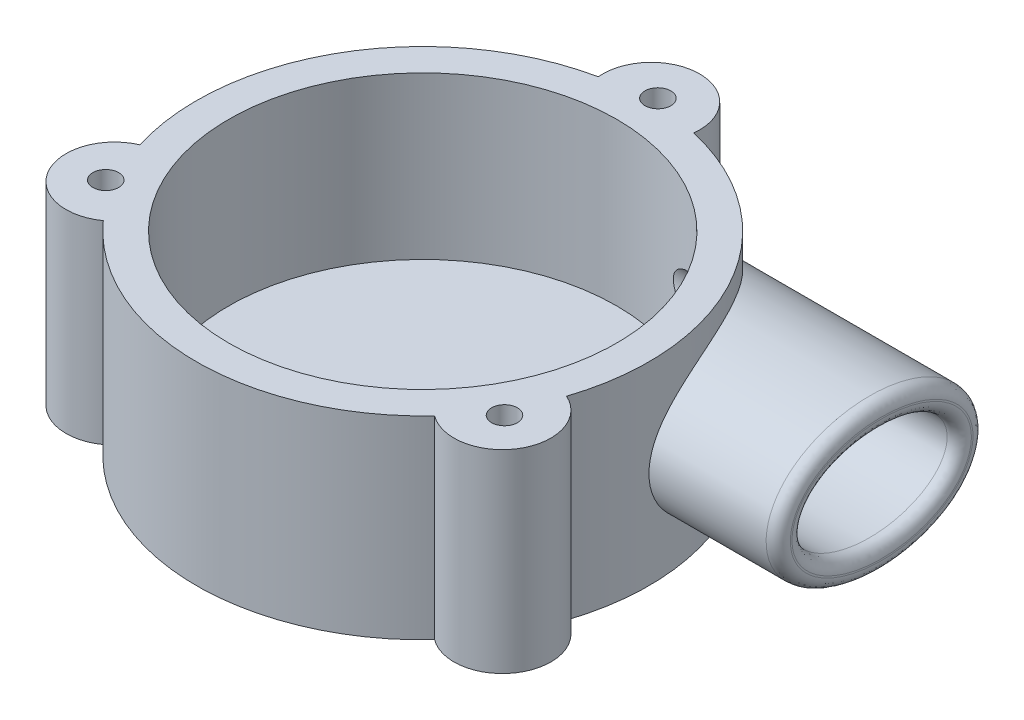
from build123d import *

# Parameters (mm, degrees)
SKETCH1_R           = 28
BOSS_EXTRUDE1_DEPTH = 4
SKETCH2_R           = 28
SKETCH2_R_2         = 24
BOSS_EXTRUDE2_DEPTH = 20
SKETCH3_R           = 0.8
CUT_EXTRUDE1_DEPTH  = 16
SKETCH4_RX          = 9.6
SKETCH4_RY          = 6
CUT_EXTRUDE2_DEPTH  = 30
BOSS_EXTRUDE3_START = -26
BOSS_EXTRUDE3_DEPTH = 42
CUT_EXTRUDE3_START  = -20
SKETCH7_R           = 24
CUT_EXTRUDE3_DEPTH  = 20
BOSS_EXTRUDE4_DEPTH = 24
SKETCH11_R          = 1.6
CUT_EXTRUDE4_DEPTH  = 61.563224081
FILLET2_R           = 1.5


# Read off the part's stored shape, not the designer's step: Boss-Extrude3
with BuildPart() as part:
    # Sketch1 → Boss-Extrude1 (new body)
    with BuildSketch(Plane(origin=(0, 0, 0), x_dir=(1, 0, 0), z_dir=(0, 1, 0))):
        with Locations(Location((0, 0, 0), (0, 0, 270))):
            Circle(SKETCH1_R)
    extrude(amount=BOSS_EXTRUDE1_DEPTH)

    # Sketch2 → Boss-Extrude2 (add)
    with BuildSketch(Plane(origin=(0, 4, 0), x_dir=(1, 0, 0), z_dir=(0, 1, 0))):
        with Locations(Location((0, 0, 0), (0, 0, 270))):
            Circle(SKETCH2_R)
        with Locations(Location((0, 0, 0), (0, 0, 270))):
            Circle(SKETCH2_R_2, mode=Mode.SUBTRACT)
    extrude(amount=BOSS_EXTRUDE2_DEPTH)

    # Sketch3 → Cut-Extrude1 (cut)
    with BuildSketch(Plane(origin=(0, 0, 0), x_dir=(-1, 0, 0), z_dir=(0, -1, 0))):
        with Locations(Location((0, 0, 0), (0, 0, 90))):
            Circle(SKETCH3_R)
    extrude(amount=-CUT_EXTRUDE1_DEPTH, mode=Mode.SUBTRACT)

    # Sketch4 → Cut-Extrude2 (cut)
    with BuildSketch(Plane(origin=(28, 0, 0), x_dir=(0, 0, -1), z_dir=(1, 0, 0))):
        with Locations(Location((12.8, 12), (0, 0, -180))):
            Ellipse(SKETCH4_RX, SKETCH4_RY)
    extrude(amount=-CUT_EXTRUDE2_DEPTH, mode=Mode.SUBTRACT)

    # Boss-Extrude3 outline → Boss-Extrude3 (add)
    # profile 1 of 2: a face of its own
    with BuildSketch(Plane(origin=(28, 0, 0), x_dir=(0, 0, -1), z_dir=(1, 0, 0)).offset(BOSS_EXTRUDE3_START)):
        with BuildLine():
            Line((6.373226639, 3.999999985), (19.226773366, 3.999999987))
            add(Edge.make_bspline(
                [(19.226773366, 3.999999987), (19.948036257, 4.292423909), (21.708793196, 5.1792085), (23.192402394, 6.437838641), (23.916521487, 7.355553728)],
                knots=[5.287932053, 5.287932053, 5.287932053, 5.287932053, 5.497787144, 5.82396377, 5.82396377, 5.82396377, 5.82396377], degree=3))
            add(Edge.make_bspline(
                [(23.916521487, 7.355553728), (24.064202763, 7.542718155), (24.618418808, 8.307278647), (25.366287729, 9.818474021), (25.6, 11.272824674), (25.6, 12)],
                knots=[5.82396377, 5.82396377, 5.82396377, 5.82396377, 5.890486225, 6.086835766, 6.283185307, 6.283185307, 6.283185307, 6.283185307], degree=3))
            add(Edge.make_bspline(
                [(25.6, 12), (25.6, 12.727175326), (25.366287729, 14.181525979), (24.618418808, 15.692721353), (24.064202763, 16.457281845), (23.916521487, 16.644446272)],
                knots=[0, 0, 0, 0, 0.196349541, 0.392699082, 0.459221537, 0.459221537, 0.459221537, 0.459221537], degree=3))
            add(Edge.make_bspline(
                [(23.916521487, 16.644446272), (23.192402394, 17.562161359), (21.202724213, 19.250118628), (17.35538116, 20.826026057), (12.8, 21.386986971), (8.24461884, 20.826026057), (4.167030634, 19.155808075), (1.512778754, 16.76609568), (0.233712271, 14.181525979), (-0.116856136, 12), (0.233712271, 9.818474021), (1.512778754, 7.23390432), (3.672693849, 5.289259988), (5.651963747, 4.292423907), (6.373226639, 3.999999985)],
                knots=[0.459221537, 0.459221537, 0.459221537, 0.459221537, 0.785398163, 1.178097245, 1.570796327, 1.963495408, 2.35619449, 2.748893572, 2.945243113, 3.141592654, 3.337942194, 3.534291735, 3.926990817, 4.136845909, 4.136845909, 4.136845909, 4.136845909], degree=3))
        make_face()
        with BuildLine():
            add(Edge.make_bspline(
                [(22.4, 12), (22.4, 22.392304845), (8, 17.196152423), (-6.4, 12), (8, 6.803847577), (22.4, 1.607695155), (22.4, 12)],
                knots=[0, 0, 0, 2.094395102, 2.094395102, 4.188790205, 4.188790205, 6.283185307, 6.283185307, 6.283185307], degree=2, weights=[1, 0.5, 1, 0.5, 1, 0.5, 1]))
        make_face(mode=Mode.SUBTRACT)
    # profile 2 of 2: a face of its own
    with BuildSketch(Plane(origin=(28, 0, 0), x_dir=(0, 0, -1), z_dir=(1, 0, 0)).offset(BOSS_EXTRUDE3_START)):
        with BuildLine():
            add(Edge.make_bspline(
                [(6.373226639, 3.999999985), (7.00165354, 3.745214855), (9.05607132, 3.074049675), (12.8, 2.613013029), (16.543928682, 3.074049676), (18.598346464, 3.745214856), (19.226773366, 3.999999987)],
                knots=[4.136845909, 4.136845909, 4.136845909, 4.136845909, 4.319689899, 4.71238898, 5.105088062, 5.287932053, 5.287932053, 5.287932053, 5.287932053], degree=3))
            Line((19.226773366, 3.999999987), (6.373226639, 3.999999985))
        make_face()
    extrude(amount=BOSS_EXTRUDE3_DEPTH)

    # Sketch7 → Cut-Extrude3 (cut)
    with BuildSketch(Plane(origin=(0, 24, 0), x_dir=(1, 0, 0), z_dir=(0, 1, 0)).offset(CUT_EXTRUDE3_START)):
        with Locations(Location((0, 0, 0), (0, 0, 270))):
            Circle(SKETCH7_R)
    extrude(amount=CUT_EXTRUDE3_DEPTH, mode=Mode.SUBTRACT)

    # Sketch10 → Boss-Extrude4 (add)
    with BuildSketch(Plane(origin=(0, 0, 0), x_dir=(-1, 0, 0), z_dir=(0, -1, 0))):
        with BuildLine():
            ThreePointArc((20.897348421, -18.636008934), (29.614006323, -16.703611271), (26.758804612, -8.244172229))
            ThreePointArc((26.758804612, -8.244172229), (24.388005207, -13.755915164), (20.897348421, -18.636008934))
        make_face()
        with BuildLine():
            ThreePointArc((-26.587931372, -8.779630137), (-29.272754857, -17.294676148), (-20.51906489, -19.051718454))
            ThreePointArc((-20.51906489, -19.051718454), (-24.106974588, -14.242674475), (-26.587931372, -8.779630137))
        make_face()
        with BuildLine():
            ThreePointArc((5.690582951, 27.415639071), (-0.341251466, 33.998287419), (-6.239739722, 27.295890683))
            ThreePointArc((-6.239739722, 27.295890683), (-0.281030619, 27.998589639), (5.690582951, 27.415639071))
        make_face()
    extrude(amount=-BOSS_EXTRUDE4_DEPTH)

    # Sketch11 → Cut-Extrude4 (cut, through all)
    with BuildSketch(Plane(origin=(0, 24, 0), x_dir=(1, 0, 0), z_dir=(0, 1, 0))):
        with Locations(Location((-25.09375403, -14.132636015, 0), (0, 0, 270))):
            Circle(SKETCH11_R)
        with Locations(Location((0.307655204, 28.798146474, 0), (0, 0, 270))):
            Circle(SKETCH11_R)
        with Locations(Location((24.786098826, -14.665510459, 0), (0, 0, 270))):
            Circle(SKETCH11_R)
    extrude(amount=-CUT_EXTRUDE4_DEPTH, mode=Mode.SUBTRACT)

    # Fillet2
    fillet2_edges = [part.edges().sort_by_distance(p)[0] for p in [
        (44, 5.377308674, -21.789365149),
        (44, 9.536022201, -25.153659531),
        (44, 2.8, -12.8),
        (44, 14.463977799, -25.153659531),
        (44, 19.423077528, -5.128881287),
        (44, 12.000000053, -3.2),
    ]]
    fillet(fillet2_edges, radius=FILLET2_R)


solid = part.part
